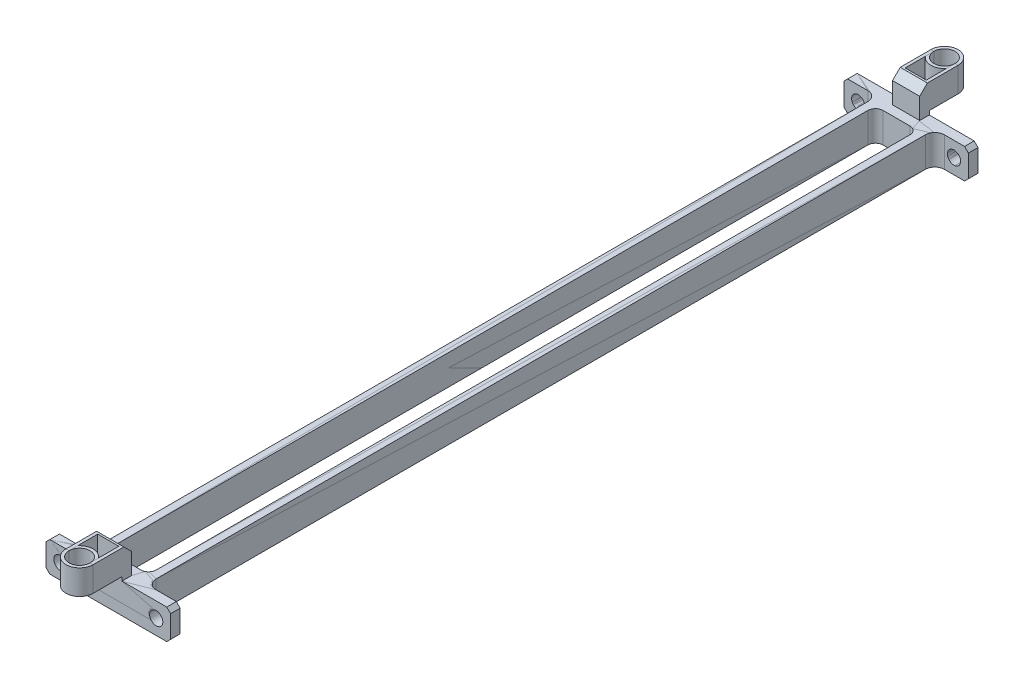
from build123d import *

# Parameters (mm, degrees)
SKETCH1_R              = 4.365625
BOSS_EXTRUDE1_DEPTH    = 6.35
SKETCH2_W              = 38.1
SKETCH2_H              = 19.84375
BOSS_EXTRUDE2_DEPTH    = 261.1
FILLET1_R              = 6.35
CUT_EXTRUDE1_DEPTH     = 177.8
SKETCH4_W              = 18
SKETCH4_H              = 6.35
BOSS_EXTRUDE3_DEPTH    = 19
SKETCH5_W              = 2
SKETCH5_H              = 19
BOSS_EXTRUDE4_DEPTH    = 19.05
BOSS_EXTRUDE6_DEPTH    = 19.05
BOSS_EXTRUDE6_2_DEPTH  = 19.05
CUT_EXTRUDE3_START     = -2.54
CUT_EXTRUDE3_OUTLINE_R = 7
CUT_EXTRUDE3_DEPTH     = 2.59
CHAMFER1_SIZE          = 5.08
CHAMFER2_SIZE          = 5.08


# Read off the part's stored shape, not the designer's step: Cut-Extrude3
with BuildPart() as part:
    # Sketch1 → Boss-Extrude1 (new body)
    with BuildSketch(Plane.XY):
        Polygon((-41.275, 7.381875), (-38.735, 9.921875), (38.735, 9.921875), (41.275, 7.381875), (41.275, -7.381875), (38.735, -9.921875), (-38.735, -9.921875), (-41.275, -7.381875), align=None)
        with Locations((31.75, 0)):
            Circle(SKETCH1_R, mode=Mode.SUBTRACT)
        with Locations(Location((-31.75, 0, 0), (0, 0, 180))):
            Circle(SKETCH1_R, mode=Mode.SUBTRACT)
    extrude(amount=BOSS_EXTRUDE1_DEPTH)

    # Sketch2 → Boss-Extrude2 (add)
    with BuildSketch(Plane.XY.offset(6.35)):
        Rectangle(SKETCH2_W, SKETCH2_H)
    extrude(amount=BOSS_EXTRUDE2_DEPTH)

    # Fillet1
    fillet1_edges = [part.edges().sort_by_distance(p)[0] for p in [
        (-19.05, 0, 6.35),
        (19.05, 0, 6.35),
    ]]
    fillet(fillet1_edges, radius=FILLET1_R)

    # Sketch3 → Cut-Extrude1 (cut)
    with BuildSketch(Plane(origin=(0, 9.921875, 0), x_dir=(1, 0, 0), z_dir=(0, 1, 0))):
        with BuildLine():
            Line((8.89, -12.7), (-8.89, -12.7))
            ThreePointArc((-8.89, -12.7), (-12.482102448, -14.187897552), (-13.97, -17.78))
            Line((-13.97, -17.78), (-13.97, -350.52))
            ThreePointArc((-13.97, -350.52), (-12.482102448, -354.112102448), (-8.89, -355.6))
            Line((-8.89, -355.6), (8.89, -355.6))
            ThreePointArc((8.89, -355.6), (12.482102448, -354.112102448), (13.97, -350.52))
            Line((13.97, -350.52), (13.97, -17.78))
            ThreePointArc((13.97, -17.78), (12.482102448, -14.187897552), (8.89, -12.7))
        make_face()
    extrude(amount=-CUT_EXTRUDE1_DEPTH, mode=Mode.SUBTRACT)

    # Mirror2: part across plane


with BuildPart() as part_1:
    add(part.part)
    add(part.part.mirror(Plane.XY.offset(267.45)))

    # Sketch4 → Boss-Extrude3 (add)
    with BuildSketch(Plane(origin=(0, 9.921875, 0), x_dir=(1, 0, 0), z_dir=(0, 1, 0))):
        with Locations((0, -3.175)):
            Rectangle(SKETCH4_W, SKETCH4_H)
    extrude(amount=BOSS_EXTRUDE3_DEPTH)

    # Sketch5 → Boss-Extrude4 (add)
    with BuildSketch(Plane(origin=(0, 0, 0), x_dir=(-1, 0, 0), z_dir=(0, 0, -1))):
        with Locations((-8, 19.421875)):
            Rectangle(SKETCH5_W, SKETCH5_H)
        with Locations((8, 19.421875)):
            Rectangle(SKETCH5_W, SKETCH5_H)
    extrude(amount=BOSS_EXTRUDE4_DEPTH)


with BuildPart() as body_2:
    # Sketch6 → Boss-Extrude6 (new body)
    with BuildSketch(Plane(origin=(0, 28.921875, 0), x_dir=(1, 0, 0), z_dir=(0, 1, 0))):
        with BuildLine():
            Line((7, 13.393145751), (7, 19.05))
            ThreePointArc((7, 19.05), (0, 12.05), (-7, 19.05))
            Line((-7, 19.05), (-7, 13.393145751))
            ThreePointArc((-7, 13.393145751), (0, 10.05), (7, 13.393145751))
        make_face()
    extrude(amount=-BOSS_EXTRUDE6_DEPTH)


with BuildPart() as body_3:
    # Sketch6 → Boss-Extrude6 2 (new body)
    with BuildSketch(Plane(origin=(0, 28.921875, 0), x_dir=(1, 0, 0), z_dir=(0, 1, 0))):
        with BuildLine():
            ThreePointArc((9, 19.05), (0, 28.05), (-9, 19.05))
            Line((-9, 19.05), (-7, 19.05))
            ThreePointArc((-7, 19.05), (0, 26.05), (7, 19.05))
            Line((7, 19.05), (9, 19.05))
        make_face()
    extrude(amount=-BOSS_EXTRUDE6_2_DEPTH)


with BuildPart() as cut_extrude3_tool:
    # Cut-Extrude3 outline → Cut-Extrude3 (new body)
    with BuildSketch(Plane(origin=(0, 9.921875, 0), x_dir=(-1, 0, 0), z_dir=(0, -1, 0)).offset(CUT_EXTRUDE3_START)):
        with BuildLine():
            Line((9, 0), (9, 19.05))
            ThreePointArc((9, 19.05), (0, 28.05), (-9, 19.05))
            Line((-9, 19.05), (-9, 0))
            Line((-9, 0), (-7, 0))
            Line((-7, 0), (-7, 13.393145751))
            ThreePointArc((-7, 13.393145751), (0, 10.05), (7, 13.393145751))
            Line((7, 13.393145751), (7, 0))
            Line((7, 0), (9, 0))
        make_face()
        with Locations((0, 19.05)):
            Circle(CUT_EXTRUDE3_OUTLINE_R, mode=Mode.SUBTRACT)
    extrude(amount=CUT_EXTRUDE3_DEPTH)


with BuildPart() as part_2:
    add(part_1.part)

    # Cut-Extrude3: cut by cut_extrude3_tool
    add(cut_extrude3_tool.part, mode=Mode.SUBTRACT)


with BuildPart() as body_2_1:
    add(body_2.part)

    # Cut-Extrude3: cut by cut_extrude3_tool
    add(cut_extrude3_tool.part, mode=Mode.SUBTRACT)


with BuildPart() as body_3_1:
    add(body_3.part)

    # Cut-Extrude3: cut by cut_extrude3_tool
    add(cut_extrude3_tool.part, mode=Mode.SUBTRACT)


with BuildPart() as body_4:
    # Mirror9: mirrored copy
    add(part_2.part.mirror(Plane(origin=(0, 0, 267.45), x_dir=(1, 0, 0), z_dir=(0, 0, -1))))

    # Chamfer2
    chamfer2_edges = [body_4.edges().sort_by_distance(p)[0] for p in [
        (0, 28.921875, 528.55),
    ]]
    chamfer(chamfer2_edges, length=CHAMFER2_SIZE)


with BuildPart() as body_5:
    # Mirror10: mirrored copy
    add(body_3_1.part.mirror(Plane(origin=(0, 0, 267.45), x_dir=(1, 0, 0), z_dir=(0, 0, -1))))


with BuildPart() as body_6:
    # Mirror10 2: mirrored copy
    add(body_2_1.part.mirror(Plane(origin=(0, 0, 267.45), x_dir=(1, 0, 0), z_dir=(0, 0, -1))))


with BuildPart() as part_3:
    add(part_2.part)

    # Chamfer1
    chamfer1_edges = [part_3.edges().sort_by_distance(p)[0] for p in [
        (0, 28.921875, 6.35),
    ]]
    chamfer(chamfer1_edges, length=CHAMFER1_SIZE)


solid = Compound([body_2_1.part, body_3_1.part, body_4.part, body_5.part, body_6.part, part_3.part])
